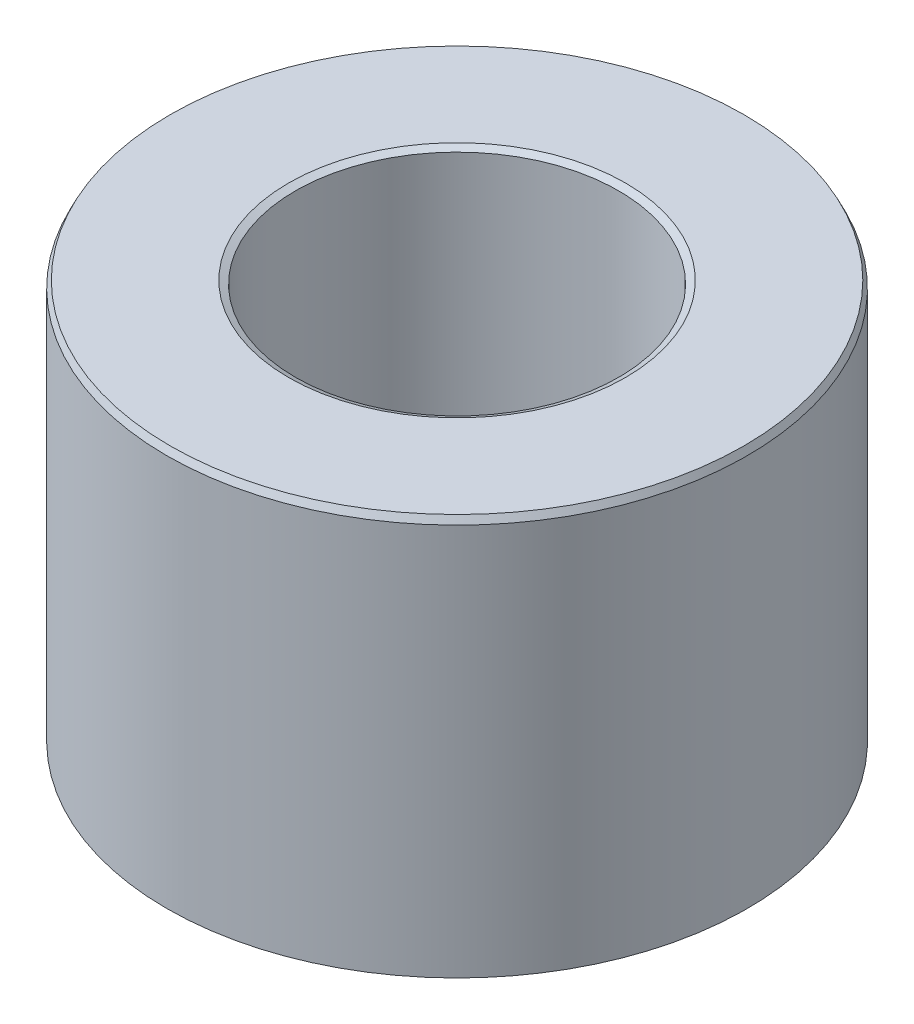
from build123d import *
from OCP.BRepFilletAPI import BRepFilletAPI_MakeChamfer

# Parameters (mm, degrees)
SKETCH1_R           = 40
BOSS_EXTRUDE1_DEPTH = 55.458671241
SKETCH2_R           = 22.275469354
CUT_EXTRUDE1_DEPTH  = 80.219089971
CHAMFER1_SIZE       = 0.947875446
CHAMFER1_SIZE2      = 0.453539457


with BuildPart() as part:
    # Sketch1 → Boss-Extrude1 (new body)
    with BuildSketch(Plane(origin=(0, 0, 0), x_dir=(1, 0, 0), z_dir=(0, 1, 0))):
        Circle(SKETCH1_R)
    extrude(amount=BOSS_EXTRUDE1_DEPTH)

    # Sketch2 → Cut-Extrude1 (cut, through all)
    with BuildSketch(Plane(origin=(0, 0, 0), x_dir=(1, 0, 0), z_dir=(0, 1, 0))):
        Circle(SKETCH2_R)
    extrude(amount=CUT_EXTRUDE1_DEPTH, mode=Mode.SUBTRACT)

    # Chamfer1: one chamfer whose edges measure the first distance from different faces: ONE call of the kernel's chamfer builder (chamfer() names one face for all edges)
    chamfer1_edges_1 = [part.edges().sort_by_distance(p)[0] for p in [
        (-22.275469354, 55.458671241, 0),
    ]]
    chamfer1_side_1 = [part.faces().sort_by_distance(p)[0] for p in [
        (-38.86862915, 55.458671241, 0),
    ]]
    chamfer1_edges_2 = [part.edges().sort_by_distance(p)[0] for p in [
        (-22.275469354, 0, 0),
    ]]
    chamfer1_side_2 = [part.faces().sort_by_distance(p)[0] for p in [
        (-22.275469354, 27.729335621, 0),
    ]]
    chamfer1_edges_3 = [part.edges().sort_by_distance(p)[0] for p in [
        (-40, 0, 0),
    ]]
    chamfer1_side_3 = [part.faces().sort_by_distance(p)[0] for p in [
        (-38.86862915, 0, 0),
    ]]
    chamfer1_edges_4 = [part.edges().sort_by_distance(p)[0] for p in [
        (-40, 55.458671241, 0),
    ]]
    chamfer1_side_4 = [part.faces().sort_by_distance(p)[0] for p in [
        (-40, 27.729335621, 0),
    ]]
    chamfer1 = BRepFilletAPI_MakeChamfer(part.part.solid().wrapped)
    for e in chamfer1_edges_1:
        chamfer1.Add(CHAMFER1_SIZE, CHAMFER1_SIZE2, e.wrapped, chamfer1_side_1[0].wrapped)  # the first distance lies on this face
    for e in chamfer1_edges_2:
        chamfer1.Add(CHAMFER1_SIZE, CHAMFER1_SIZE2, e.wrapped, chamfer1_side_2[0].wrapped)  # the first distance lies on this face
    for e in chamfer1_edges_3:
        chamfer1.Add(CHAMFER1_SIZE, CHAMFER1_SIZE2, e.wrapped, chamfer1_side_3[0].wrapped)  # the first distance lies on this face
    for e in chamfer1_edges_4:
        chamfer1.Add(CHAMFER1_SIZE, CHAMFER1_SIZE2, e.wrapped, chamfer1_side_4[0].wrapped)  # the first distance lies on this face
    add(Compound.cast(chamfer1.Shape()), mode=Mode.REPLACE)


solid = part.part
